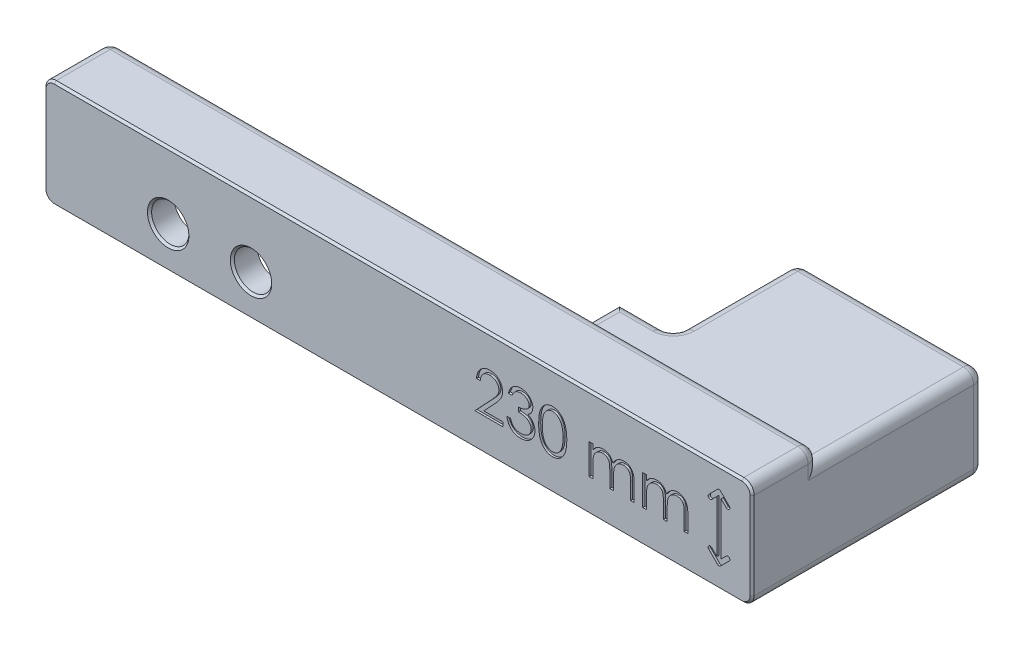
from build123d import *

# Parameters (mm, degrees)
MAIN_FEATURES_SKETCH_W   = 171
MAIN_FEATURES_SKETCH_H   = 26
MAIN_FEATURES_SKETCH_R   = 4.5
BASE_DEPTH               = 6
LEDGE_DEPTH              = 10
MAIN_FEATURES_SKETCH_4_W = 13
MAIN_FEATURES_SKETCH_4_H = 22.60000006
BOSS_EXTRUDE3_DEPTH      = 20
MAIN_FEATURES_SKETCH_5_W = 45
MAIN_FEATURES_SKETCH_5_H = 22.60000006
BOSS_EXTRUDE4_DEPTH      = 50
FILLET1_R                = 2.5
CHAMFER1_SIZE            = 0.5
CUT_EXTRUDE1_DEPTH       = 0.5
CUT_EXTRUDE2_DEPTH       = 0.5


with BuildPart() as part:
    # main_features_sketch → base (new body)
    with BuildSketch(Plane.XY):
        with Locations((79.5, 293)):
            Rectangle(MAIN_FEATURES_SKETCH_W, MAIN_FEATURES_SKETCH_H)
        with Locations((44, 290)):
            Circle(MAIN_FEATURES_SKETCH_R, mode=Mode.SUBTRACT)
        with Locations((24, 290)):
            Circle(MAIN_FEATURES_SKETCH_R, mode=Mode.SUBTRACT)
    extrude(amount=BASE_DEPTH)

    # main_features_sketch<3> → ledge (add)
    with BuildSketch(Plane.XY):
        Polygon((0, 280), (0, 300), (107, 300), (107, 302.60000006), (165, 302.60000006), (165, 306), (-6, 306), (-6, 280), align=None)
    extrude(amount=-LEDGE_DEPTH)

    # main_features_sketch<4> → Boss-Extrude3 (add)
    with BuildSketch(Plane.XY):
        with Locations((113.5, 291.30000003)):
            Rectangle(MAIN_FEATURES_SKETCH_4_W, MAIN_FEATURES_SKETCH_4_H)
    extrude(amount=-BOSS_EXTRUDE3_DEPTH)

    # main_features_sketch<5> → Boss-Extrude4 (add)
    with BuildSketch(Plane.XY):
        with Locations((142.5, 291.30000003)):
            Rectangle(MAIN_FEATURES_SKETCH_5_W, MAIN_FEATURES_SKETCH_5_H)
    extrude(amount=-BOSS_EXTRUDE4_DEPTH)

    # Fillet1
    fillet1_edges = [part.edges().sort_by_distance(p)[0] for p in [
        (113.5, 280, -20),
        (113.5, 302.60000006, -20),
        (142.5, 280, -50),
        (165, 291.30000003, -50),
        (142.5, 302.60000006, -50),
        (120, 291.30000003, -50),
        (165, 304.30000003, -10),
        (79.5, 306, -10),
        (-6, 293, -10),
        (0, 280, -5),
        (120, 291.30000003, -20),
        (120, 302.60000006, -35),
        (107, 302.60000006, -15),
        (120, 280, -35),
        (107, 280, -10),
        (-6, 280, -2),
        (-6, 306, -2),
        (165, 306, -2),
        (165, 302.60000006, -30),
        (165, 280, -22),
    ]]
    fillet(fillet1_edges, radius=FILLET1_R)

    # Chamfer1
    chamfer1_edges = [part.edges().sort_by_distance(p)[0] for p in [
        (39.5, 290, 6),
        (19.5, 290, 6),
        (-5.267766953, 305.267766953, 6),
        (79.5, 306, 6),
        (164.267766953, 305.267766953, 6),
        (165, 293, 6),
        (164.267766953, 280.732233047, 6),
        (79.5, 280, 6),
        (-5.267766953, 280.732233047, 6),
        (-6, 293, 6),
    ]]
    chamfer(chamfer1_edges, length=CHAMFER1_SIZE)

    # Sketch3 → Cut-Extrude1 (cut)
    with BuildSketch(Plane.XY.offset(6)):
        with BuildLine():
            Line((156.646446609, 300.853553391), (154.525126266, 298.732233047))
            ThreePointArc((154.525126266, 298.732233047), (154.525126266, 298.025126266), (155.232233047, 298.025126266))
            Line((155.232233047, 298.025126266), (157.353553391, 300.146446609))
            ThreePointArc((157.353553391, 300.146446609), (157.353553391, 300.853553391), (156.646446609, 300.853553391))
        make_face()
        with BuildLine():
            Line((156.5, 300.5), (156.5, 285.5))
            ThreePointArc((156.5, 285.5), (157, 285), (157.5, 285.5))
            Line((157.5, 285.5), (157.5, 300.5))
            ThreePointArc((157.5, 300.5), (157, 301), (156.5, 300.5))
        make_face()
        with BuildLine():
            Line((156.646446609, 300.146446609), (158.767766953, 298.025126266))
            ThreePointArc((158.767766953, 298.025126266), (159.474873734, 298.025126266), (159.474873734, 298.732233047))
            Line((159.474873734, 298.732233047), (157.353553391, 300.853553391))
            ThreePointArc((157.353553391, 300.853553391), (156.646446609, 300.853553391), (156.646446609, 300.146446609))
        make_face()
        with BuildLine():
            Line((157.353553391, 285.146446609), (159.474873734, 287.267766953))
            ThreePointArc((159.474873734, 287.267766953), (159.474873734, 287.974873734), (158.767766953, 287.974873734))
            Line((158.767766953, 287.974873734), (156.646446609, 285.853553391))
            ThreePointArc((156.646446609, 285.853553391), (156.646446609, 285.146446609), (157.353553391, 285.146446609))
        make_face()
        with BuildLine():
            Line((157.353553391, 285.853553391), (155.232233047, 287.974873734))
            ThreePointArc((155.232233047, 287.974873734), (154.525126266, 287.974873734), (154.525126266, 287.267766953))
            Line((154.525126266, 287.267766953), (156.646446609, 285.146446609))
            ThreePointArc((156.646446609, 285.146446609), (157.353553391, 285.146446609), (157.353553391, 285.853553391))
        make_face()
    extrude(amount=-CUT_EXTRUDE1_DEPTH, mode=Mode.SUBTRACT)

    # Sketch4 → Cut-Extrude2 (cut)
    # profile 1 of 5: a face of its own
    with BuildSketch(Plane.XY.offset(6)):
        with BuildLine():
            Line((99.34998023, 294.923076923), (98.452544333, 294.923076923))
            add(Edge.make_bspline(
                [(98.452544333, 294.923076923), (98.458393341, 295.042136602), (98.469880638, 295.275966644), (98.523675751, 295.616892091), (98.600649685, 295.942762944), (98.709482411, 296.250962699), (98.844643205, 296.544216434), (99.006728997, 296.821359336), (99.198711427, 297.08133416), (99.416444953, 297.321730856), (99.652926779, 297.542266772), (99.908086606, 297.732710323), (100.176215255, 297.893617955), (100.456499253, 298.028135789), (100.752100863, 298.129106778), (101.060337599, 298.204025748), (101.382563703, 298.249101021), (101.602106624, 298.253946123), (101.713762281, 298.256410256)],
                knots=[0, 0, 0, 0, 1.10065271, 2.161652631, 3.183658789, 4.190468796, 5.17591951, 6.163126047, 7.15150782, 8.156236427, 9.156009102, 10.134482811, 11.092018607, 12.041330605, 13.001268258, 13.972401359, 14.968799086, 16, 16, 16, 16], degree=3))
            add(Edge.make_bspline(
                [(101.713762281, 298.256410256), (101.823413921, 298.253843238), (102.038875478, 298.248799139), (102.353338376, 298.205481912), (102.652702075, 298.137637365), (102.936381407, 298.042450461), (103.202113021, 297.914494954), (103.451893148, 297.760787701), (103.688695464, 297.583016754), (103.901857703, 297.373720144), (104.097595073, 297.15028476), (104.266458659, 296.911747892), (104.411067697, 296.665378505), (104.531603925, 296.409297929), (104.620335751, 296.14109499), (104.68770206, 295.864674411), (104.725780384, 295.577174951), (104.731624452, 295.382584792), (104.734595615, 295.283653846)],
                knots=[0, 0, 0, 0, 1.111607364, 2.184268762, 3.212621178, 4.221274766, 5.211760367, 6.196651075, 7.1921475, 8.207485113, 9.220403448, 10.201281604, 11.166441695, 12.114753415, 13.065576456, 14.026450734, 14.996634279, 16, 16, 16, 16], degree=3))
            add(Edge.make_bspline(
                [(104.734595615, 295.283653846), (104.729757721, 295.144374319), (104.720166831, 294.868259423), (104.638125755, 294.462502672), (104.509992866, 294.069378617), (104.355714704, 293.752986326), (104.200079149, 293.498033486), (104.059829128, 293.288122901), (103.895643953, 293.062107277), (103.705133959, 292.820743456), (103.492240039, 292.56214087), (103.255033858, 292.28645574), (102.991823909, 291.996536398), (102.807085336, 291.798520394), (102.711358435, 291.695913462)],
                knots=[0, 0, 0, 0, 1.184426356, 2.348067706, 3.509069118, 4.696110526, 5.333549288, 6.050745305, 6.844228056, 7.710549037, 8.667450064, 9.695053472, 10.805634456, 12, 12, 12, 12], degree=3))
            Line((102.711358435, 291.695913462), (100.20935523, 289.025641026))
            Line((100.20935523, 289.025641026), (104.862800743, 289.025641026))
            Line((104.862800743, 289.025641026), (104.862800743, 288))
            Line((104.862800743, 288), (98.067928948, 288))
            Line((98.067928948, 288), (101.946134076, 292.138621795))
            add(Edge.make_bspline(
                [(101.946134076, 292.138621795), (102.04055661, 292.237188385), (102.221922973, 292.426514632), (102.478444621, 292.70292309), (102.708841731, 292.959350349), (102.91460571, 293.195311916), (103.091272868, 293.414259253), (103.248050674, 293.609101263), (103.373666648, 293.788399693), (103.50999635, 293.996230018), (103.642036297, 294.249979496), (103.755500171, 294.560075751), (103.824685452, 294.879296473), (103.832984982, 295.095016578), (103.837159717, 295.203525641)],
                knots=[0, 0, 0, 0, 1.329631726, 2.553950428, 3.673215718, 4.687767853, 5.603093632, 6.413772471, 7.123043292, 7.734684054, 8.834405432, 9.900288307, 10.943827018, 12, 12, 12, 12], degree=3))
            add(Edge.make_bspline(
                [(103.837159717, 295.203525641), (103.835343311, 295.271758208), (103.831763522, 295.406231495), (103.800170101, 295.603390806), (103.752425797, 295.793575988), (103.684010774, 295.977372043), (103.593705803, 296.152931049), (103.48378186, 296.320466707), (103.356953108, 296.482435179), (103.210235195, 296.634301745), (103.049059424, 296.773390903), (102.87879014, 296.896602576), (102.698646985, 296.999571464), (102.509389493, 297.083981456), (102.311545295, 297.150196831), (102.104731737, 297.196078486), (101.889520262, 297.224885583), (101.742567417, 297.228783217), (101.667688563, 297.230769231)],
                knots=[0, 0, 0, 0, 0.991446411, 1.95395049, 2.89581595, 3.838931463, 4.798493298, 5.75982156, 6.748411868, 7.785213223, 8.824556874, 9.840280684, 10.836137867, 11.835679398, 12.848801643, 13.863922112, 14.911575587, 16, 16, 16, 16], degree=3))
            add(Edge.make_bspline(
                [(101.667688563, 297.230769231), (101.589486184, 297.228726281), (101.435909623, 297.224714266), (101.210426672, 297.196649512), (100.995324451, 297.148232825), (100.790061871, 297.082013756), (100.594291626, 296.997846473), (100.408965785, 296.893012917), (100.234500388, 296.767917222), (100.070567464, 296.626087061), (99.919527524, 296.468179629), (99.786822164, 296.292151163), (99.670867838, 296.101215691), (99.569698599, 295.895888404), (99.487539485, 295.674306175), (99.424759055, 295.43725559), (99.37508235, 295.185765928), (99.358486577, 295.012094257), (99.34998023, 294.923076923)],
                knots=[0, 0, 0, 0, 1.031018746, 2.02475058, 2.990194455, 3.934040569, 4.864654155, 5.795059489, 6.735614925, 7.690564532, 8.649604399, 9.611025574, 10.590972636, 11.591080095, 12.624614302, 13.701020113, 14.821632451, 16, 16, 16, 16], degree=3))
        make_face()
    # profile 2 of 5: a face of its own
    with BuildSketch(Plane.XY.offset(6)):
        with BuildLine():
            Line((107.042287922, 295.692307692), (106.144852025, 295.692307692))
            add(Edge.make_bspline(
                [(106.144852025, 295.692307692), (106.169165027, 295.792971932), (106.216694957, 295.989762288), (106.315830881, 296.27092589), (106.423828753, 296.536993094), (106.553511909, 296.782981876), (106.694965493, 297.013835884), (106.857030411, 297.224319097), (107.032229619, 297.419784712), (107.226015188, 297.593251105), (107.429239936, 297.750330332), (107.644767421, 297.884259067), (107.868261402, 297.999470932), (108.101270354, 298.09438588), (108.344487987, 298.165887377), (108.595715482, 298.217763964), (108.855611197, 298.251452862), (109.032032884, 298.254740756), (109.121614845, 298.256410256)],
                knots=[0, 0, 0, 0, 1.162005537, 2.271625781, 3.343758855, 4.383309926, 5.390229558, 6.379919256, 7.361854164, 8.333198761, 9.295911338, 10.242430842, 11.177959212, 12.116337295, 13.062827104, 14.020064771, 14.994644689, 16, 16, 16, 16], degree=3))
            add(Edge.make_bspline(
                [(109.121614845, 298.256410256), (109.252136966, 298.252469599), (109.51033414, 298.24467424), (109.889657131, 298.173490136), (110.255448043, 298.060846901), (110.603703036, 297.90520768), (110.927184272, 297.713243928), (111.215001949, 297.484773251), (111.463254837, 297.224203819), (111.671524487, 296.936396492), (111.834595913, 296.628809322), (111.954842695, 296.312237445), (112.028047497, 295.987431812), (112.037534803, 295.7681253), (112.042287922, 295.658253205)],
                knots=[0, 0, 0, 0, 1.083050992, 2.142477498, 3.193116406, 4.255571735, 5.30263384, 6.308962982, 7.297363603, 8.282367274, 9.249857812, 10.179914175, 11.08814088, 12, 12, 12, 12], degree=3))
            add(Edge.make_bspline(
                [(112.042287922, 295.658253205), (112.038963376, 295.552519506), (112.032457756, 295.345615065), (111.977218597, 295.043553644), (111.884257846, 294.758863358), (111.755487096, 294.490345752), (111.588796953, 294.239703352), (111.386874961, 294.006372235), (111.148295928, 293.789317498), (110.967498962, 293.664976147), (110.874419333, 293.600961538)],
                knots=[0, 0, 0, 0, 1.024540389, 2.004866551, 2.965041327, 3.920577974, 4.882998113, 5.874504559, 6.905732034, 8, 8, 8, 8], degree=3))
            add(Edge.make_bspline(
                [(110.874419333, 293.600961538), (110.980795774, 293.549595334), (111.191558272, 293.447824027), (111.478845499, 293.248236148), (111.739639429, 293.017789441), (111.885078626, 292.83795329), (111.958153307, 292.747596154)],
                knots=[0, 0, 0, 0, 1.015518401, 2.012035669, 3.001164323, 4, 4, 4, 4], degree=3))
            add(Edge.make_bspline(
                [(111.958153307, 292.747596154), (112.006271428, 292.681716864), (112.101719702, 292.551037102), (112.219535513, 292.340933028), (112.326418697, 292.128500201), (112.409705038, 291.908044756), (112.4742018, 291.682121859), (112.520304749, 291.450343585), (112.548945152, 291.212520664), (112.553046729, 291.051627863), (112.555108435, 290.970753205)],
                knots=[0, 0, 0, 0, 1.025084078, 2.033381695, 3.024893161, 4.013698104, 4.991890475, 5.976764909, 6.982997093, 8, 8, 8, 8], degree=3))
            add(Edge.make_bspline(
                [(112.555108435, 290.970753205), (112.549981254, 290.83072543), (112.539751019, 290.551328854), (112.448310807, 290.138543935), (112.306558691, 289.7350425), (112.105253159, 289.349114387), (111.85991742, 288.988027585), (111.568039351, 288.664952416), (111.232935327, 288.387242118), (110.859204901, 288.155212895), (110.45429882, 287.969733117), (110.0212257, 287.840997566), (109.566225546, 287.757151853), (109.254204696, 287.748160799), (109.095573179, 287.743589744)],
                knots=[0, 0, 0, 0, 0.955779014, 1.907060117, 2.875433937, 3.871313158, 4.872415639, 5.851225146, 6.836215519, 7.83643374, 8.849228613, 9.86973379, 10.916971861, 12, 12, 12, 12], degree=3))
            add(Edge.make_bspline(
                [(109.095573179, 287.743589744), (108.988660892, 287.746070353), (108.778293163, 287.750951365), (108.469026025, 287.784318797), (108.17382117, 287.845261669), (107.892279462, 287.927271113), (107.624150786, 288.031247519), (107.370253343, 288.160729513), (107.129025076, 288.31304809), (106.902742358, 288.490001198), (106.691432165, 288.687947883), (106.500710095, 288.910402198), (106.327396401, 289.153251923), (106.176131719, 289.419317798), (106.04002614, 289.70516139), (105.92808055, 290.014442814), (105.829550354, 290.344397163), (105.783740456, 290.574333563), (105.76023664, 290.692307692)],
                knots=[0, 0, 0, 0, 1.048658725, 2.063410685, 3.046034179, 4.001477787, 4.936774919, 5.862367409, 6.792675028, 7.730719943, 8.675894397, 9.627829632, 10.600096036, 11.597688215, 12.626045268, 13.701542398, 14.82072376, 16, 16, 16, 16], degree=3))
            Line((105.76023664, 290.692307692), (106.657672538, 290.692307692))
            add(Edge.make_bspline(
                [(106.657672538, 290.692307692), (106.68105337, 290.615310512), (106.726531121, 290.465544307), (106.803943401, 290.250000576), (106.892138464, 290.052406139), (106.986751489, 289.871311504), (107.086118477, 289.704933212), (107.197303978, 289.557670729), (107.312072964, 289.423055865), (107.398585402, 289.347214117), (107.440925743, 289.310096154)],
                knots=[0, 0, 0, 0, 1.198163088, 2.33053128, 3.407730985, 4.417276592, 5.372219308, 6.28897303, 7.162600585, 8, 8, 8, 8], degree=3))
            add(Edge.make_bspline(
                [(107.440925743, 289.310096154), (107.496915961, 289.266929486), (107.60872357, 289.180729395), (107.790918516, 289.070724742), (107.982532476, 288.975407527), (108.187717259, 288.902596967), (108.402045175, 288.840946508), (108.628980504, 288.800602168), (108.866521125, 288.772921678), (109.028714734, 288.770479017), (109.11159882, 288.769230769)],
                knots=[0, 0, 0, 0, 0.946170439, 1.889420265, 2.845303464, 3.807233317, 4.801018734, 5.828864929, 6.890507805, 8, 8, 8, 8], degree=3))
            add(Edge.make_bspline(
                [(109.11159882, 288.769230769), (109.205180256, 288.770990499), (109.388170676, 288.774431497), (109.655184559, 288.806076374), (109.909205838, 288.852163269), (110.147414198, 288.92334322), (110.372929933, 289.01128851), (110.582591789, 289.121712526), (110.779152092, 289.251268873), (110.960093251, 289.398523612), (111.122794701, 289.559727884), (111.266050453, 289.728336659), (111.3878352, 289.903639029), (111.486073995, 290.086605088), (111.563646996, 290.276477171), (111.61645614, 290.473788112), (111.653174755, 290.676923158), (111.656165075, 290.815005927), (111.657672538, 290.884615385)],
                knots=[0, 0, 0, 0, 1.217147791, 2.380027433, 3.494444702, 4.572153297, 5.609568379, 6.639424714, 7.649109417, 8.668170816, 9.669597737, 10.625200337, 11.543417969, 12.441394052, 13.322311151, 14.205496177, 15.095365482, 16, 16, 16, 16], degree=3))
            add(Edge.make_bspline(
                [(111.657672538, 290.884615385), (111.653300248, 290.977790639), (111.644577423, 291.163677519), (111.577981482, 291.437156303), (111.46844187, 291.700651767), (111.315091838, 291.94966831), (111.128418327, 292.1804566), (110.910232879, 292.386375122), (110.658723655, 292.556289667), (110.427238315, 292.673685829), (110.222195011, 292.753791758), (110.046722484, 292.807148799), (109.850275046, 292.852330672), (109.635228335, 292.894365734), (109.399962002, 292.930141014), (109.144732179, 292.959974774), (108.869487146, 292.983846319), (108.678940958, 292.994506591), (108.580749461, 293)],
                knots=[0, 0, 0, 0, 1.07054697, 2.135767047, 3.216561865, 4.33974944, 5.486079747, 6.621378074, 7.775625952, 8.963672916, 9.598146892, 10.304877434, 11.070270905, 11.915000392, 12.823868403, 13.805723172, 14.86925407, 16, 16, 16, 16], degree=3))
            Line((108.580749461, 293), (108.580749461, 294.025641026))
            add(Edge.make_bspline(
                [(108.580749461, 294.025641026), (108.704467077, 294.027740465), (108.946799496, 294.031852751), (109.300783224, 294.081589923), (109.639278401, 294.150391718), (109.954783378, 294.255777981), (110.242351131, 294.378178829), (110.491835708, 294.520613714), (110.699741843, 294.678941569), (110.86505919, 294.855606167), (110.989428415, 295.045077731), (111.080362122, 295.242553896), (111.13407734, 295.449765498), (111.141247817, 295.591178835), (111.144852025, 295.662259615)],
                knots=[0, 0, 0, 0, 1.321986639, 2.589447074, 3.816329219, 5.01088745, 6.139805852, 7.153945165, 8.075214402, 8.924034688, 9.728124013, 10.488707548, 11.240355623, 12, 12, 12, 12], degree=3))
            add(Edge.make_bspline(
                [(111.144852025, 295.662259615), (111.143667994, 295.714481744), (111.141312419, 295.818375193), (111.111605911, 295.970161104), (111.066965794, 296.117306664), (111.005595139, 296.259186121), (110.923451714, 296.394815475), (110.825148896, 296.525351044), (110.708097181, 296.650047555), (110.573967332, 296.76627704), (110.429933603, 296.877046289), (110.272077103, 296.971085252), (110.105157461, 297.051499715), (109.928989876, 297.117812578), (109.743002647, 297.167696258), (109.548069625, 297.203512948), (109.3438191, 297.225906247), (109.204471295, 297.229130293), (109.133634076, 297.230769231)],
                knots=[0, 0, 0, 0, 0.884392785, 1.759457502, 2.611959086, 3.489218968, 4.37281399, 5.2945488, 6.255912374, 7.266815255, 8.301784654, 9.332968512, 10.37626691, 11.440494194, 12.520033166, 13.637162961, 14.798855837, 16, 16, 16, 16], degree=3))
            add(Edge.make_bspline(
                [(109.133634076, 297.230769231), (109.019772168, 297.226793911), (108.797373378, 297.219029186), (108.47675933, 297.151020576), (108.17870409, 297.042511766), (107.950879328, 296.912988854), (107.782643402, 296.785130471), (107.662423578, 296.67346651), (107.544364977, 296.549372728), (107.436234472, 296.405205942), (107.326880253, 296.250729398), (107.227324363, 296.078090308), (107.130582385, 295.891792039), (107.072289386, 295.760090226), (107.042287922, 295.692307692)],
                knots=[0, 0, 0, 0, 1.472543308, 2.876219568, 4.221790263, 5.565193594, 6.249813518, 6.953379497, 7.687249741, 8.463570142, 9.283606569, 10.136032583, 11.040678096, 12, 12, 12, 12], degree=3))
        make_face()
    # profile 3 of 5: a face of its own
    with BuildSketch(Plane.XY.offset(6)):
        with BuildLine():
            add(Edge.make_bspline(
                [(113.452544333, 292.99599359), (113.453481527, 293.15627184), (113.455302042, 293.467614653), (113.475554673, 293.921285058), (113.509198508, 294.346885884), (113.555305288, 294.744437501), (113.611413802, 295.114042543), (113.686315193, 295.454713278), (113.771494629, 295.768026439), (113.870215903, 296.055003721), (113.981609585, 296.319511444), (114.10285033, 296.56644059), (114.238749743, 296.79541754), (114.381540923, 297.010096941), (114.537003985, 297.20696464), (114.700714815, 297.388800819), (114.879063032, 297.551402963), (115.065985913, 297.699535256), (115.263175811, 297.829390889), (115.465012, 297.943770142), (115.672883731, 298.041484049), (115.88735854, 298.118313865), (116.106508705, 298.181773428), (116.331100324, 298.225170421), (116.561504221, 298.252475874), (116.717022606, 298.255086353), (116.795893691, 298.256410256)],
                knots=[0, 0, 0, 0, 1.646270934, 3.197905019, 4.663502075, 6.030701355, 7.308322542, 8.50163776, 9.611534131, 10.641858119, 11.616356847, 12.558055219, 13.465016945, 14.349605745, 15.204443733, 16.039544428, 16.859896111, 17.680448484, 18.487036065, 19.28249412, 20.06191084, 20.843045899, 21.620316918, 22.403196591, 23.190181807, 24, 24, 24, 24], degree=3))
            add(Edge.make_bspline(
                [(116.795893691, 298.256410256), (116.87542363, 298.255016499), (117.033583655, 298.252244753), (117.267413299, 298.225604918), (117.495840961, 298.181401709), (117.717892786, 298.118770353), (117.935392747, 298.041068419), (118.146639626, 297.943676656), (118.352945574, 297.830308464), (118.55103211, 297.697097386), (118.743073868, 297.548576597), (118.924353762, 297.380683257), (119.094888293, 297.195112631), (119.256817737, 296.993850163), (119.405548015, 296.773035634), (119.547186393, 296.536509606), (119.673963638, 296.280135707), (119.79606271, 296.008191513), (119.901454101, 295.713152488), (119.996500516, 295.396681744), (120.073297569, 295.05504121), (120.137266918, 294.690023366), (120.186823764, 294.3002877), (120.222917027, 293.886669655), (120.241982984, 293.448897111), (120.245573559, 293.14958897), (120.247416127, 292.99599359)],
                knots=[0, 0, 0, 0, 0.810914788, 1.612654377, 2.396697861, 3.181598691, 3.963628158, 4.749916497, 5.551656086, 6.361998678, 7.18212741, 8.025565596, 8.878627764, 9.750805457, 10.657531673, 11.591944965, 12.560506719, 13.57287815, 14.630710178, 15.753379473, 16.941251878, 18.199788006, 19.531962791, 20.947069417, 22.433333509, 24, 24, 24, 24], degree=3))
            add(Edge.make_bspline(
                [(120.247416127, 292.99599359), (120.245554457, 292.843068138), (120.241927069, 292.545099133), (120.223130764, 292.109296347), (120.186106103, 291.697873366), (120.139791851, 291.309843473), (120.075646243, 290.946821705), (119.996774339, 290.607551852), (119.909201988, 290.29056879), (119.801102576, 289.998469328), (119.682786261, 289.727178692), (119.554057129, 289.473843982), (119.41614334, 289.236226003), (119.265889783, 289.016226726), (119.105737174, 288.812287706), (118.932257777, 288.628008784), (118.75034182, 288.458949721), (118.557734918, 288.3085165), (118.356559057, 288.17684563), (118.150961694, 288.059091771), (117.937294885, 287.964141214), (117.720400734, 287.882612526), (117.497176831, 287.82032552), (117.267901429, 287.777257362), (117.033740755, 287.74705208), (116.875450569, 287.744747852), (116.795893691, 287.743589744)],
                knots=[0, 0, 0, 0, 1.561518951, 3.042555995, 4.452378317, 5.7783523, 7.031515105, 8.214008947, 9.334062868, 10.386615937, 11.391082383, 12.354592575, 13.286541444, 14.194233754, 15.072674879, 15.931287219, 16.775624067, 17.606195743, 18.42308326, 19.229000347, 20.022332153, 20.807536673, 21.593273796, 22.3848459, 23.188221202, 24, 24, 24, 24], degree=3))
            add(Edge.make_bspline(
                [(116.795893691, 287.743589744), (116.717024794, 287.744922188), (116.561510724, 287.747549508), (116.331075222, 287.774731598), (116.107411098, 287.818433035), (115.889414658, 287.879623333), (115.675967472, 287.954522865), (115.469978082, 288.052104818), (115.269156128, 288.164487872), (115.074037397, 288.292474791), (114.888288365, 288.439108171), (114.710863779, 288.601291853), (114.546220867, 288.783073028), (114.392980594, 288.98158138), (114.247340342, 289.194990644), (114.113370704, 289.426214567), (113.989453978, 289.674336311), (113.876186862, 289.940958913), (113.775762109, 290.229972993), (113.687054371, 290.544684931), (113.617013921, 290.887872463), (113.55706262, 291.256779226), (113.50870724, 291.652990456), (113.475694882, 292.076721251), (113.455291125, 292.527707562), (113.453476638, 292.837049774), (113.452544333, 292.99599359)],
                knots=[0, 0, 0, 0, 0.810891512, 1.598919785, 2.382837074, 3.152667961, 3.926044502, 4.706494248, 5.493654104, 6.291793342, 7.103789334, 7.925228297, 8.761435821, 9.622817696, 10.50288917, 11.416980706, 12.369136599, 13.353924996, 14.394355917, 15.514179734, 16.714354668, 17.994756427, 19.357759367, 20.818452758, 22.365282078, 24, 24, 24, 24], degree=3))
        make_face()
        with BuildLine():
            add(Edge.make_bspline(
                [(114.34998023, 293), (114.350321507, 292.866432289), (114.35098386, 292.60720359), (114.36828729, 292.230508558), (114.391859381, 291.879164762), (114.422263087, 291.552726086), (114.467414369, 291.252297479), (114.518005191, 290.97581267), (114.579571162, 290.72473485), (114.65241407, 290.497341105), (114.735382918, 290.289772338), (114.8259711, 290.096626009), (114.923287451, 289.915620476), (115.03219931, 289.748381595), (115.150813776, 289.594363984), (115.27645166, 289.450841605), (115.4138019, 289.32285023), (115.603812593, 289.16934493), (115.854659663, 289.010718834), (116.170718107, 288.872587149), (116.495485109, 288.78578013), (116.715917252, 288.774740827), (116.825941768, 288.769230769)],
                knots=[0, 0, 0, 0, 1.459021318, 2.831673884, 4.118529203, 5.306027144, 6.411944654, 7.436330062, 8.375795394, 9.233974572, 10.042671642, 10.816086306, 11.563610507, 12.285937304, 12.993564865, 13.685989202, 14.367179055, 15.041617293, 16.353048772, 17.594441528, 18.799311195, 20, 20, 20, 20], degree=3))
            add(Edge.make_bspline(
                [(116.825941768, 288.769230769), (116.936677973, 288.773795857), (117.157921754, 288.782916608), (117.481161168, 288.870913001), (117.79496194, 289.003683113), (118.040881769, 289.160675986), (118.227974751, 289.310185499), (118.362023294, 289.437655922), (118.485057718, 289.580386972), (118.601749361, 289.73438496), (118.708775291, 289.902592058), (118.806098542, 290.084199416), (118.894908106, 290.279711353), (118.94550538, 290.416196322), (118.971374461, 290.485977564)],
                knots=[0, 0, 0, 0, 1.353760809, 2.704726607, 4.075137775, 5.516104923, 6.260822281, 7.007110065, 7.778089737, 8.566572457, 9.372053459, 10.217411131, 11.088608312, 12, 12, 12, 12], degree=3))
            add(Edge.make_bspline(
                [(118.971374461, 290.485977564), (119.001522369, 290.575205391), (119.062735551, 290.756376146), (119.141626335, 291.037415152), (119.203756047, 291.332280192), (119.259651377, 291.639209097), (119.297802966, 291.960465385), (119.328511004, 292.295055054), (119.346598681, 292.643230374), (119.348840827, 292.879787492), (119.34998023, 293)],
                knots=[0, 0, 0, 0, 0.884706709, 1.796334032, 2.740027952, 3.714592787, 4.726048262, 5.777819803, 6.87074269, 8, 8, 8, 8], degree=3))
            add(Edge.make_bspline(
                [(119.34998023, 293), (119.348408261, 293.120193064), (119.345333153, 293.355316392), (119.333578902, 293.699654051), (119.303225832, 294.026704797), (119.269514064, 294.337877576), (119.219807718, 294.631449869), (119.166213984, 294.909879313), (119.094210521, 295.169716527), (119.017296878, 295.415029617), (118.929267176, 295.643031487), (118.832365078, 295.854785163), (118.728874339, 296.051312948), (118.616467938, 296.232075638), (118.496480272, 296.397882903), (118.365744417, 296.545410316), (118.229446209, 296.679230225), (118.038539964, 296.831980423), (117.788613421, 296.987728124), (117.477625858, 297.131058866), (117.153995445, 297.213368274), (116.935214148, 297.224973094), (116.825941768, 297.230769231)],
                knots=[0, 0, 0, 0, 1.31362396, 2.569729283, 3.763502607, 4.902122613, 5.988968491, 7.01645872, 7.998833611, 8.933434873, 9.825090667, 10.667526885, 11.477055099, 12.250526234, 12.991942729, 13.710640831, 14.402115721, 15.076753259, 16.378508321, 17.609869233, 18.806226677, 20, 20, 20, 20], degree=3))
            add(Edge.make_bspline(
                [(116.825941768, 297.230769231), (116.715340077, 297.224965097), (116.493935204, 297.213346257), (116.166941047, 297.131365533), (115.853500043, 296.988471344), (115.604234401, 296.831464566), (115.413195011, 296.681926533), (115.278673029, 296.55225095), (115.152541109, 296.410404509), (115.03634768, 296.254970467), (114.927521157, 296.08792656), (114.827575406, 295.907958661), (114.737525893, 295.714154763), (114.654427218, 295.506679233), (114.581362109, 295.279305106), (114.521093643, 295.028536553), (114.465416348, 294.752931148), (114.426001294, 294.450875411), (114.390961992, 294.124354973), (114.368443855, 293.772134064), (114.350925977, 293.394807262), (114.350301793, 293.134238238), (114.34998023, 293)],
                knots=[0, 0, 0, 0, 1.207732386, 2.417664972, 3.655092373, 4.956220595, 5.625982001, 6.301752483, 6.994047911, 7.697131622, 8.419323945, 9.170223765, 9.943494443, 10.752040957, 11.610060368, 12.549350801, 13.567764191, 14.679664412, 15.874934091, 17.154273443, 18.533957287, 20, 20, 20, 20], degree=3))
        make_face(mode=Mode.SUBTRACT)
    # profile 4 of 5: a face of its own
    with BuildSketch(Plane.XY.offset(6)):
        with BuildLine():
            Line((125.632031512, 295.307692308), (126.529467409, 295.307692308))
            Line((126.529467409, 295.307692308), (126.529467409, 294.037660256))
            add(Edge.make_bspline(
                [(126.529467409, 294.037660256), (126.610278695, 294.14876769), (126.765120865, 294.361660184), (127.01902273, 294.642203854), (127.272668765, 294.880284296), (127.45533557, 295.005263929), (127.543089204, 295.065304487)],
                knots=[0, 0, 0, 0, 1.134379233, 2.173579362, 3.122582517, 4, 4, 4, 4], degree=3))
            add(Edge.make_bspline(
                [(127.543089204, 295.065304487), (127.662702525, 295.122462674), (127.899839381, 295.235780426), (128.275322881, 295.350733452), (128.659536223, 295.421376598), (128.918988262, 295.431037665), (129.049499461, 295.435897436)],
                knots=[0, 0, 0, 0, 1.014936303, 2.012140481, 3.000054389, 4, 4, 4, 4], degree=3))
            add(Edge.make_bspline(
                [(129.049499461, 295.435897436), (129.137765165, 295.432910891), (129.312438248, 295.427000679), (129.571249934, 295.388543435), (129.822274539, 295.322068655), (130.064028909, 295.229476301), (130.291802278, 295.11734291), (130.500628558, 294.985772316), (130.688126295, 294.838066386), (130.854200728, 294.667555149), (131.0035408, 294.469450582), (131.140908933, 294.238409871), (131.267838112, 293.969245125), (131.338184708, 293.773912151), (131.375220615, 293.671073718)],
                knots=[0, 0, 0, 0, 1.009824226, 1.998387844, 2.986035974, 3.974953746, 4.955485308, 5.885931332, 6.793869504, 7.679848016, 8.601185859, 9.625726857, 10.749998409, 12, 12, 12, 12], degree=3))
            add(Edge.make_bspline(
                [(131.375220615, 293.671073718), (131.414395618, 293.741714916), (131.491486525, 293.880726873), (131.620931202, 294.077464765), (131.756553478, 294.26148417), (131.899509172, 294.432931097), (132.049293706, 294.590958898), (132.206611992, 294.736090046), (132.370568511, 294.868947799), (132.598546339, 295.024156826), (132.895153789, 295.189017345), (133.269119831, 295.331955756), (133.658120321, 295.420287551), (133.922170888, 295.430659759), (134.055509076, 295.435897436)],
                knots=[0, 0, 0, 0, 0.86119277, 1.694706429, 2.50939023, 3.298075842, 4.073795165, 4.829715201, 5.57930267, 6.321991688, 7.768977793, 9.186738141, 10.579381044, 12, 12, 12, 12], degree=3))
            add(Edge.make_bspline(
                [(134.055509076, 295.435897436), (134.178027541, 295.431276805), (134.417808073, 295.422233781), (134.766885976, 295.351223858), (135.092433991, 295.229287723), (135.393797065, 295.062905904), (135.665682247, 294.853822523), (135.902014558, 294.605054416), (136.101358454, 294.318361207), (136.231583139, 294.048669811), (136.319912465, 293.81056886), (136.374373134, 293.607693742), (136.422486549, 293.384403591), (136.462432964, 293.140431415), (136.491628827, 292.874915391), (136.513259443, 292.588290032), (136.527899653, 292.28033257), (136.528934145, 292.067859712), (136.529467409, 291.958333333)],
                knots=[0, 0, 0, 0, 1.209669288, 2.367440248, 3.500751976, 4.631527125, 5.755587489, 6.87532382, 8.007944318, 9.190864318, 9.82315674, 10.514484317, 11.263564316, 12.079023757, 12.955305781, 13.901327259, 14.918167583, 16, 16, 16, 16], degree=3))
            Line((136.529467409, 291.958333333), (136.529467409, 288))
            Line((136.529467409, 288), (135.632031512, 288))
            Line((135.632031512, 288), (135.632031512, 291.962339744))
            add(Edge.make_bspline(
                [(135.632031512, 291.962339744), (135.631808989, 292.055827098), (135.631381334, 292.235495574), (135.623685244, 292.493359721), (135.609184347, 292.72841217), (135.592228236, 292.940332422), (135.568674495, 293.129614675), (135.538257547, 293.295878728), (135.506035605, 293.440432474), (135.452504201, 293.600678325), (135.366938797, 293.777450355), (135.23660314, 293.968089143), (135.072402836, 294.134034286), (134.882802389, 294.27808662), (134.666949689, 294.395211309), (134.42905048, 294.478857051), (134.170581762, 294.530636703), (133.991659509, 294.535796748), (133.899259076, 294.538461538)],
                knots=[0, 0, 0, 0, 1.253487763, 2.409012846, 3.458416907, 4.410876679, 5.259312806, 6.014470957, 6.676830364, 7.243083969, 8.276244668, 9.299465089, 10.325150304, 11.392391894, 12.482080715, 13.603491619, 14.762376348, 16, 16, 16, 16], degree=3))
            add(Edge.make_bspline(
                [(133.899259076, 294.538461538), (133.785916349, 294.534415375), (133.561908032, 294.526418616), (133.234920928, 294.444778979), (132.920718024, 294.321692549), (132.628674787, 294.1433141), (132.360023956, 293.929575917), (132.128882306, 293.675434215), (131.937933204, 293.387920138), (131.80863613, 293.121786703), (131.726952412, 292.882731149), (131.673018367, 292.673881515), (131.63106582, 292.436505607), (131.59172145, 292.17219849), (131.566042228, 291.879140832), (131.542704021, 291.558688258), (131.53178727, 291.209876945), (131.530260245, 290.968086406), (131.529467409, 290.842548077)],
                knots=[0, 0, 0, 0, 1.090531906, 2.155305635, 3.229839962, 4.33261226, 5.44038871, 6.529323825, 7.629011124, 8.757537029, 9.370236727, 10.061839251, 10.834451254, 11.692844982, 12.636905849, 13.66920014, 14.789842145, 16, 16, 16, 16], degree=3))
            Line((131.529467409, 290.842548077), (131.529467409, 288))
            Line((131.529467409, 288), (130.632031512, 288))
            Line((130.632031512, 288), (130.632031512, 291.715945513))
            add(Edge.make_bspline(
                [(130.632031512, 291.715945513), (130.631804566, 291.820783566), (130.631367946, 292.022481444), (130.623721325, 292.311720516), (130.60918812, 292.574809317), (130.592386553, 292.81144207), (130.568214615, 293.021188724), (130.540758151, 293.205173747), (130.50833355, 293.362935893), (130.454648165, 293.535974135), (130.372606827, 293.726605344), (130.240640365, 293.929865404), (130.076047278, 294.107774254), (129.882987632, 294.259656393), (129.66582854, 294.385203482), (129.425875967, 294.475659916), (129.165290501, 294.528300743), (128.985639913, 294.535010734), (128.893249461, 294.538461538)],
                knots=[0, 0, 0, 0, 1.320475261, 2.540461679, 3.643808994, 4.639130445, 5.527981419, 6.302341397, 6.981980563, 7.553956391, 8.582137848, 9.585246428, 10.591171744, 11.620968678, 12.668337649, 13.738356861, 14.836885341, 16, 16, 16, 16], degree=3))
            add(Edge.make_bspline(
                [(128.893249461, 294.538461538), (128.784631714, 294.534088796), (128.568160401, 294.525374074), (128.250154774, 294.446933292), (127.94305282, 294.324064507), (127.651753681, 294.153607881), (127.384113257, 293.942467656), (127.149803922, 293.694139383), (126.952825278, 293.411713573), (126.822162949, 293.148386383), (126.737881595, 292.915319883), (126.681894924, 292.717174318), (126.633781708, 292.497173609), (126.59802736, 292.254639006), (126.563511887, 291.991150165), (126.546853861, 291.70539448), (126.530649398, 291.397617087), (126.52987107, 291.1851241), (126.529467409, 291.074919872)],
                knots=[0, 0, 0, 0, 1.098833095, 2.189935336, 3.297829714, 4.440610912, 5.596351641, 6.740013378, 7.886572111, 9.072425424, 9.705826452, 10.395263256, 11.156850408, 11.985370555, 12.878090359, 13.847760091, 14.883794034, 16, 16, 16, 16], degree=3))
            Line((126.529467409, 291.074919872), (126.529467409, 288))
            Line((126.529467409, 288), (125.632031512, 288))
            Line((125.632031512, 288), (125.632031512, 295.307692308))
        make_face()
    # profile 5 of 5: a face of its own
    with BuildSketch(Plane.XY.offset(6)):
        with BuildLine():
            Line((138.580749461, 295.307692308), (139.478185358, 295.307692308))
            Line((139.478185358, 295.307692308), (139.478185358, 294.037660256))
            add(Edge.make_bspline(
                [(139.478185358, 294.037660256), (139.558996644, 294.14876769), (139.713838814, 294.361660184), (139.967740678, 294.642203854), (140.221386714, 294.880284296), (140.404053519, 295.005263929), (140.491807153, 295.065304487)],
                knots=[0, 0, 0, 0, 1.134379233, 2.173579362, 3.122582517, 4, 4, 4, 4], degree=3))
            add(Edge.make_bspline(
                [(140.491807153, 295.065304487), (140.611420474, 295.122462674), (140.84855733, 295.235780426), (141.22404083, 295.350733452), (141.608254171, 295.421376598), (141.867706211, 295.431037665), (141.998217409, 295.435897436)],
                knots=[0, 0, 0, 0, 1.014936303, 2.012140481, 3.000054389, 4, 4, 4, 4], degree=3))
            add(Edge.make_bspline(
                [(141.998217409, 295.435897436), (142.086483114, 295.432910891), (142.261156197, 295.427000679), (142.519967883, 295.388543435), (142.770992488, 295.322068655), (143.012746858, 295.229476301), (143.240520227, 295.11734291), (143.449346506, 294.985772316), (143.636844244, 294.838066386), (143.802918676, 294.667555149), (143.952258749, 294.469450582), (144.089626882, 294.238409871), (144.21655606, 293.969245125), (144.286902657, 293.773912151), (144.323938563, 293.671073718)],
                knots=[0, 0, 0, 0, 1.009824226, 1.998387844, 2.986035974, 3.974953746, 4.955485308, 5.885931332, 6.793869504, 7.679848016, 8.601185859, 9.625726857, 10.749998409, 12, 12, 12, 12], degree=3))
            add(Edge.make_bspline(
                [(144.323938563, 293.671073718), (144.363113567, 293.741714916), (144.440204473, 293.880726873), (144.569649151, 294.077464765), (144.705271426, 294.26148417), (144.848227121, 294.432931097), (144.998011655, 294.590958898), (145.155329941, 294.736090046), (145.319286459, 294.868947799), (145.547264288, 295.024156826), (145.843871737, 295.189017345), (146.217837779, 295.331955756), (146.60683827, 295.420287551), (146.870888836, 295.430659759), (147.004227025, 295.435897436)],
                knots=[0, 0, 0, 0, 0.86119277, 1.694706429, 2.50939023, 3.298075842, 4.073795165, 4.829715201, 5.57930267, 6.321991688, 7.768977793, 9.186738141, 10.579381044, 12, 12, 12, 12], degree=3))
            add(Edge.make_bspline(
                [(147.004227025, 295.435897436), (147.12674549, 295.431276805), (147.366526022, 295.422233781), (147.715603924, 295.351223858), (148.041151939, 295.229287723), (148.342515014, 295.062905904), (148.614400195, 294.853822523), (148.850732507, 294.605054416), (149.050076402, 294.318361207), (149.180301087, 294.048669811), (149.268630414, 293.81056886), (149.323091083, 293.607693742), (149.371204498, 293.384403591), (149.411150913, 293.140431415), (149.440346776, 292.874915391), (149.461977392, 292.588290032), (149.476617602, 292.28033257), (149.477652094, 292.067859712), (149.478185358, 291.958333333)],
                knots=[0, 0, 0, 0, 1.209669288, 2.367440248, 3.500751976, 4.631527125, 5.755587489, 6.87532382, 8.007944318, 9.190864318, 9.82315674, 10.514484317, 11.263564316, 12.079023757, 12.955305781, 13.901327259, 14.918167583, 16, 16, 16, 16], degree=3))
            Line((149.478185358, 291.958333333), (149.478185358, 288))
            Line((149.478185358, 288), (148.580749461, 288))
            Line((148.580749461, 288), (148.580749461, 291.962339744))
            add(Edge.make_bspline(
                [(148.580749461, 291.962339744), (148.580526938, 292.055827098), (148.580099283, 292.235495574), (148.572403193, 292.493359721), (148.557902295, 292.72841217), (148.540946185, 292.940332422), (148.517392444, 293.129614675), (148.486975496, 293.295878728), (148.454753553, 293.440432474), (148.40122215, 293.600678325), (148.315656745, 293.777450355), (148.185321088, 293.968089143), (148.021120785, 294.134034286), (147.831520337, 294.27808662), (147.615667638, 294.395211309), (147.377768429, 294.478857051), (147.11929971, 294.530636703), (146.940377458, 294.535796748), (146.847977025, 294.538461538)],
                knots=[0, 0, 0, 0, 1.253487763, 2.409012846, 3.458416907, 4.410876679, 5.259312806, 6.014470957, 6.676830364, 7.243083969, 8.276244668, 9.299465089, 10.325150304, 11.392391894, 12.482080715, 13.603491619, 14.762376348, 16, 16, 16, 16], degree=3))
            add(Edge.make_bspline(
                [(146.847977025, 294.538461538), (146.734634298, 294.534415375), (146.51062598, 294.526418616), (146.183638877, 294.444778979), (145.869435972, 294.321692549), (145.577392735, 294.1433141), (145.308741905, 293.929575917), (145.077600254, 293.675434215), (144.886651152, 293.387920138), (144.757354078, 293.121786703), (144.67567036, 292.882731149), (144.621736315, 292.673881515), (144.579783768, 292.436505607), (144.540439399, 292.17219849), (144.514760176, 291.879140832), (144.49142197, 291.558688258), (144.480505219, 291.209876945), (144.478978194, 290.968086406), (144.478185358, 290.842548077)],
                knots=[0, 0, 0, 0, 1.090531906, 2.155305635, 3.229839962, 4.33261226, 5.44038871, 6.529323825, 7.629011124, 8.757537029, 9.370236727, 10.061839251, 10.834451254, 11.692844982, 12.636905849, 13.66920014, 14.789842145, 16, 16, 16, 16], degree=3))
            Line((144.478185358, 290.842548077), (144.478185358, 288))
            Line((144.478185358, 288), (143.580749461, 288))
            Line((143.580749461, 288), (143.580749461, 291.715945513))
            add(Edge.make_bspline(
                [(143.580749461, 291.715945513), (143.580522515, 291.820783566), (143.580085894, 292.022481444), (143.572439274, 292.311720516), (143.557906069, 292.574809317), (143.541104502, 292.81144207), (143.516932563, 293.021188724), (143.4894761, 293.205173747), (143.457051499, 293.362935893), (143.403366114, 293.535974135), (143.321324776, 293.726605344), (143.189358313, 293.929865404), (143.024765226, 294.107774254), (142.831705581, 294.259656393), (142.614546489, 294.385203482), (142.374593915, 294.475659916), (142.11400845, 294.528300743), (141.934357862, 294.535010734), (141.841967409, 294.538461538)],
                knots=[0, 0, 0, 0, 1.320475261, 2.540461679, 3.643808994, 4.639130445, 5.527981419, 6.302341397, 6.981980563, 7.553956391, 8.582137848, 9.585246428, 10.591171744, 11.620968678, 12.668337649, 13.738356861, 14.836885341, 16, 16, 16, 16], degree=3))
            add(Edge.make_bspline(
                [(141.841967409, 294.538461538), (141.733349662, 294.534088796), (141.51687835, 294.525374074), (141.198872722, 294.446933292), (140.891770769, 294.324064507), (140.60047163, 294.153607881), (140.332831206, 293.942467656), (140.098521871, 293.694139383), (139.901543226, 293.411713573), (139.770880898, 293.148386383), (139.686599544, 292.915319883), (139.630612873, 292.717174318), (139.582499656, 292.497173609), (139.546745309, 292.254639006), (139.512229836, 291.991150165), (139.49557181, 291.70539448), (139.479367346, 291.397617087), (139.478589019, 291.1851241), (139.478185358, 291.074919872)],
                knots=[0, 0, 0, 0, 1.098833095, 2.189935336, 3.297829714, 4.440610912, 5.596351641, 6.740013378, 7.886572111, 9.072425424, 9.705826452, 10.395263256, 11.156850408, 11.985370555, 12.878090359, 13.847760091, 14.883794034, 16, 16, 16, 16], degree=3))
            Line((139.478185358, 291.074919872), (139.478185358, 288))
            Line((139.478185358, 288), (138.580749461, 288))
            Line((138.580749461, 288), (138.580749461, 295.307692308))
        make_face()
    extrude(amount=-CUT_EXTRUDE2_DEPTH, mode=Mode.SUBTRACT)


solid = part.part
